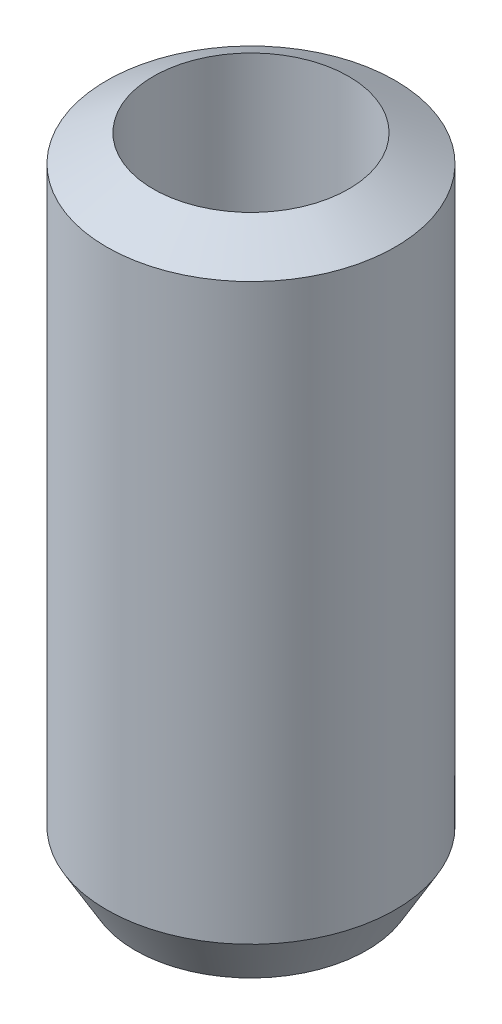
from build123d import *

# Parameters (mm, degrees)
SKETCH1_R           = 20
BOSS_EXTRUDE1_DEPTH = 90.338043
SKETCH2_R           = 13.538814639
CUT_EXTRUDE1_DEPTH  = 95.662357952
CHAMFER1_SIZE       = 3.944521
CHAMFER1_SIZE_2     = 6.83211


with BuildPart() as part:
    # Sketch1 → Boss-Extrude1 (new body)
    with BuildSketch(Plane(origin=(0, 0, 0), x_dir=(1, 0, 0), z_dir=(0, 1, 0))):
        with Locations(Location((0, 0, 0), (0, 0, 270))):
            Circle(SKETCH1_R)
    extrude(amount=BOSS_EXTRUDE1_DEPTH)

    # Sketch2 → Cut-Extrude1 (cut, through all)
    with BuildSketch(Plane(origin=(0, 0, 0), x_dir=(1, 0, 0), z_dir=(0, 1, 0))):
        with Locations(Location((0, 0, 0), (0, 0, 270))):
            Circle(SKETCH2_R)
    extrude(amount=CUT_EXTRUDE1_DEPTH, mode=Mode.SUBTRACT)

    # Chamfer1
    # the kernel refuses this chamfer: 6.83211, 3.944521 mm, written as the material it takes off along each edge
    with BuildSketch(Plane(origin=(0, 90.338043, 0), x_dir=(0, 0, 1), z_dir=(-1, 0, 0))) as chamfer1_piece_1:
        Polygon((20, -CHAMFER1_SIZE), (20 - CHAMFER1_SIZE_2, 0), (20, 0), align=None)
    revolve(axis=Axis((0, 90.338043, 0), (0, 1, 0)), mode=Mode.SUBTRACT)
    with BuildSketch(Plane(origin=(0, 0, 0), x_dir=(0, 0, 1), z_dir=(-1, 0, 0))) as chamfer1_piece_2:
        Polygon((20, CHAMFER1_SIZE_2), (20 - CHAMFER1_SIZE, 0), (20, 0), align=None)
    revolve(axis=Axis((0, 0, 0), (0, 1, 0)), mode=Mode.SUBTRACT)


solid = part.part
